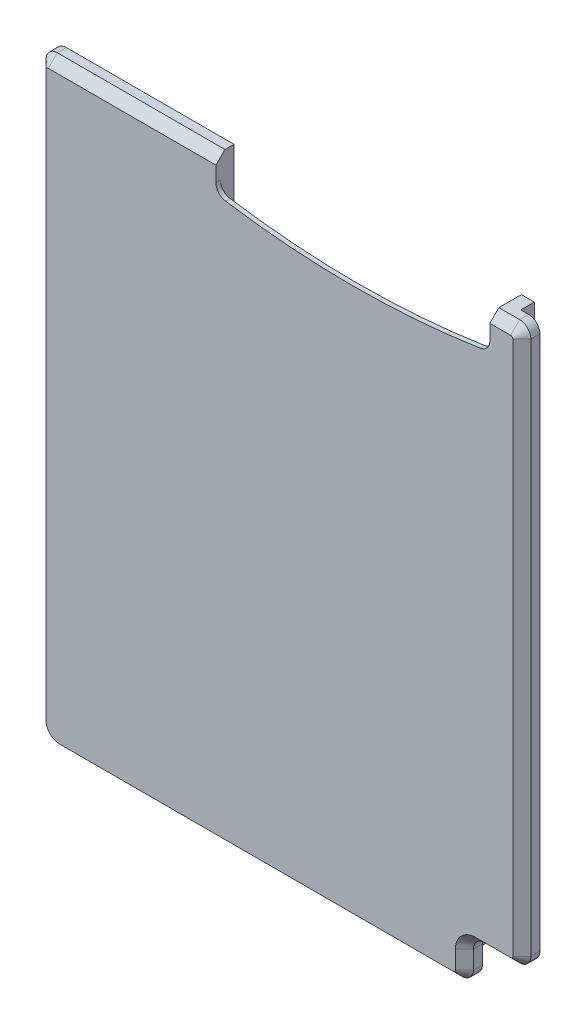
from build123d import *

# Parameters (mm, degrees)
SKIZZE2_W                                   = 21.5
SKIZZE2_H                                   = 26.5
AUFSATZ_LINEAR_AUSTRAGEN1_DEPTH             = 0.8
AUFSATZ_LINEAR_AUSTRAGEN2_DEPTH             = 0.6
SCHNITT_LINEAR_AUSTRAGEN2_DEPTH             = 0.7
SCHNITT_LINEAR_AUSTRAGEN2_DEPTH_BACK        = 40.270886163
SKIZZE5_W                                   = 12.144981168
SKIZZE5_H                                   = 8.613973721
SCHNITT_LINEAR_AUSTRAGEN1_DEPTH             = 0.4
SCHNITT_LINEAR_AUSTRAGEN1_DEPTH_BACK        = 40.270886163
SCHNITT_LINEAR_AUSTRAGEN3_DEPTH             = 0.6
SCHNITT_LINEAR_AUSTRAGEN3_DEPTH_BACK        = 40.270886163
SKIZZE6_W                                   = 12.144981168
SKIZZE6_H                                   = 8.023619308
VERRUNDUNG1_R                               = 0.5
SCHNITT_LINEAR_AUSTRAGEN4_DEPTH             = 40.270886163
SCHNITT_LINEAR_AUSTRAGEN4_DEPTH_BACK        = 40.270886163
VERRUNDUNG3_R                               = 0.5
SKIZZE8_W                                   = 5.461913831
SKIZZE8_H                                   = 1.2
SKIZZE8_W_2                                 = 0.8
SKIZZE8_H_2                                 = 4.167109648
AUFSATZ_LINEAR_AUSTRAGEN3_DEPTH             = 0.6
AUFSATZ_LINEAR_AUSTRAGEN3_DIRECTION_2_REACH = 41.271
SCHNITT_LINEAR_AUSTRAGEN5_DEPTH             = 40.270886163
SCHNITT_LINEAR_AUSTRAGEN5_DEPTH_BACK        = 40.270886163
SKIZZE9_W                                   = 2.954983754
SKIZZE9_H                                   = 2.164950306
SKIZZE10_W                                  = 0.770433568
SKIZZE10_H                                  = 2.170677495
AUFSATZ_LINEAR_AUSTRAGEN4_DEPTH             = 0.8
VERRUNDUNG2_R                               = 1
VERRUNDUNG4_R                               = 0.5
FASE1_SIZE                                  = 0.4


with BuildPart() as part:
    # Skizze2 → Aufsatz-Linear austragen1 (new body)
    with BuildSketch(Plane.XY.offset(1.2)):
        with Locations((12, 18.75)):
            Rectangle(SKIZZE2_W, SKIZZE2_H)
    extrude(amount=AUFSATZ_LINEAR_AUSTRAGEN1_DEPTH)

    # Skizze3 → Aufsatz-Linear austragen2 (add)
    with BuildSketch(Plane.XY.offset(1.2)):
        Polygon((21.9, 32), (21.9, 16.15), (19.9, 16.15), (19.9, 6.15), (2.1, 6.15), (2.1, 25.65), (10, 25.65), (10, 32), align=None)
    extrude(amount=-AUFSATZ_LINEAR_AUSTRAGEN2_DEPTH)

    # Skizze5 → Schnitt-Linear austragen2 (cut, two sides: drawn at the far end of the back side and taken through both)
    with BuildSketch(Plane.XY.offset(1.2).offset(-SCHNITT_LINEAR_AUSTRAGEN2_DEPTH_BACK)):
        with Locations((15.254893919, 20.77736777)):
            Rectangle(SKIZZE5_W, SKIZZE5_H)
    extrude(amount=SCHNITT_LINEAR_AUSTRAGEN2_DEPTH + SCHNITT_LINEAR_AUSTRAGEN2_DEPTH_BACK, mode=Mode.SUBTRACT)

    # Skizze4 → Schnitt-Linear austragen1 (cut, two sides: drawn at the far end of the back side and taken through both)
    with BuildSketch(Plane.XY.offset(1.2).offset(-SCHNITT_LINEAR_AUSTRAGEN1_DEPTH_BACK)):
        Polygon((8.382403335, 24.511668734), (5.015709698, 24.511668734), (5.015709698, 25.65), (2.1, 25.65), (2.1, 24.134887808), (2.6, 24.134887808), (2.6, 6.15), (7.902667193, 6.15), (7.902667193, 7.35), (10.352191741, 7.35), (10.352191741, 6.15), (16.321024544, 6.15), (16.321024544, 6.65), (19.9, 6.65), (19.9, 10.624393956), (18.922805677, 10.624393956), (18.922805677, 12.094523693), (18.263327803, 12.094523693), (18.263327803, 15.67038091), (19.9, 15.67038091), (19.9, 16.15), (21.327384503, 16.15), (21.327384503, 16.47038091), (16.321024544, 16.47038091), (16.321024544, 15.67038091), (5.294026876, 15.67038091), (5.294026876, 17.554984477), (8.382403335, 17.554984477), align=None)
    extrude(amount=SCHNITT_LINEAR_AUSTRAGEN1_DEPTH + SCHNITT_LINEAR_AUSTRAGEN1_DEPTH_BACK, mode=Mode.SUBTRACT)

    # Skizze6 → Schnitt-Linear austragen3 (cut, two sides: drawn at the far end of the back side and taken through both)
    with BuildSketch(Plane.XY.offset(1.2).offset(-SCHNITT_LINEAR_AUSTRAGEN3_DEPTH_BACK)):
        with Locations((15.254893919, 29.096164285)):
            Rectangle(SKIZZE6_W, SKIZZE6_H)
    extrude(amount=SCHNITT_LINEAR_AUSTRAGEN3_DEPTH + SCHNITT_LINEAR_AUSTRAGEN3_DEPTH_BACK, mode=Mode.SUBTRACT)

    # Verrundung1
    verrundung1_edges = [part.edges().sort_by_distance(p)[0] for p in [
        (21.9, 16.15, 0.9),
        (2.1, 25.65, 1.4),
        (2.1, 6.15, 0.9),
        (19.9, 6.15, 0.9),
    ]]
    fillet(verrundung1_edges, radius=VERRUNDUNG1_R - 0.0001)  # a hair under: the kernel refuses the full size

    # Skizze7 → Schnitt-Linear austragen4 (cut, two sides: drawn at the far end of the back side and taken through both)
    with BuildSketch(Plane.XY.offset(1.2).offset(-SCHNITT_LINEAR_AUSTRAGEN4_DEPTH_BACK)):
        with BuildLine():
            Line((21.327384503, 30.5), (21.327384503, 32.799881912))
            Line((21.327384503, 32.799881912), (9.182403335, 32.799881912))
            Line((9.182403335, 32.799881912), (9.182403335, 30.5))
            ThreePointArc((9.182403335, 30.5), (15.254893919, 30), (21.327384503, 30.5))
        make_face()
    extrude(amount=SCHNITT_LINEAR_AUSTRAGEN4_DEPTH + SCHNITT_LINEAR_AUSTRAGEN4_DEPTH_BACK, mode=Mode.SUBTRACT)

    # Verrundung3
    verrundung3_edges = [part.edges().sort_by_distance(p)[0] for p in [
        (9.182403335, 30.5, 1.9),
        (21.327384503, 30.5, 1.9),
    ]]
    fillet(verrundung3_edges, radius=VERRUNDUNG3_R)

    # Skizze8 → Aufsatz-Linear austragen3 (add)
    with BuildSketch(Plane.XY.offset(1.2)):
        with Locations((4.988422265, 11.700335539)):
            Rectangle(SKIZZE8_W, SKIZZE8_H)
        with Locations((16.376411907, 10.759758473)):
            Rectangle(SKIZZE8_W_2, SKIZZE8_H_2)
    extrude(amount=-AUFSATZ_LINEAR_AUSTRAGEN3_DEPTH)

    # Skizze8 → Aufsatz-Linear austragen3 direction 2 (add, up to next)
    with BuildSketch(Plane.XY.offset(1.2), mode=Mode.PRIVATE) as aufsatz_linear_austragen3_direction_2_sk1:
        with Locations((4.988422265, 11.700335539)):
            Rectangle(SKIZZE8_W, SKIZZE8_H)
    aufsatz_linear_austragen3_direction_2_tool1 = extrude(aufsatz_linear_austragen3_direction_2_sk1.sketch, amount=AUFSATZ_LINEAR_AUSTRAGEN3_DIRECTION_2_REACH, mode=Mode.PRIVATE) - part.part
    # Skizze8 → Aufsatz-Linear austragen3 direction 2 (add, up to next)
    with BuildSketch(Plane.XY.offset(1.2), mode=Mode.PRIVATE) as aufsatz_linear_austragen3_direction_2_sk2:
        with Locations((16.376411907, 10.759758473)):
            Rectangle(SKIZZE8_W_2, SKIZZE8_H_2)
    aufsatz_linear_austragen3_direction_2_tool2 = extrude(aufsatz_linear_austragen3_direction_2_sk2.sketch, amount=AUFSATZ_LINEAR_AUSTRAGEN3_DIRECTION_2_REACH, mode=Mode.PRIVATE) - part.part
    add(aufsatz_linear_austragen3_direction_2_tool1.solids().sort_by_distance((4.988422, 11.700336, 1.2))[0])
    add(aufsatz_linear_austragen3_direction_2_tool2.solids().sort_by_distance((16.376412, 10.759758, 1.2))[0])

    # Skizze9 → Schnitt-Linear austragen5 (cut, two sides: drawn at the far end of the back side and taken through both)
    with BuildSketch(Plane.XY.offset(1.2).offset(-SCHNITT_LINEAR_AUSTRAGEN5_DEPTH_BACK)):
        with Locations((21.677491877, 6.217524847)):
            Rectangle(SKIZZE9_W, SKIZZE9_H)
    extrude(amount=SCHNITT_LINEAR_AUSTRAGEN5_DEPTH + SCHNITT_LINEAR_AUSTRAGEN5_DEPTH_BACK, mode=Mode.SUBTRACT)

    # Skizze10 → Aufsatz-Linear austragen4 (add)
    with BuildSketch(Plane.XY.offset(1.2)):
        with Locations((19.652022519, 6.998720979)):
            Rectangle(SKIZZE10_W, SKIZZE10_H)
    extrude(amount=AUFSATZ_LINEAR_AUSTRAGEN4_DEPTH)

    # Verrundung2
    verrundung2_edges = [part.edges().sort_by_distance(p)[0] for p in [
        (1.25, 5.5, 1.6),
    ]]
    fillet(verrundung2_edges, radius=VERRUNDUNG2_R)

    # Verrundung4
    verrundung4_edges = [part.edges().sort_by_distance(p)[0] for p in [
        (22.75, 7.3, 1.6),
        (20.2, 5.5, 1.6),
        (20.2, 7.3, 1.6),
        (1.25, 32, 1.6),
        (22.75, 32, 1.6),
    ]]
    fillet(verrundung4_edges, radius=VERRUNDUNG4_R)

    # Fase1
    fase1_edges = [part.edges().sort_by_distance(p)[0] for p in [
        (5.466201668, 32, 2),
        (10.975, 5.5, 2),
        (1.542893219, 5.792893219, 2),
        (22.75, 19.65, 2),
        (21.475, 7.3, 2),
        (1.25, 19, 2),
        (20.2, 6.4, 2),
        (21.788692251, 32, 2),
        (1.396446609, 31.853553391, 2),
        (22.603553391, 31.853553391, 2),
        (20.053553391, 5.646446609, 2),
        (22.603553391, 7.446446609, 2),
        (20.346446609, 7.153553391, 2),
    ]]
    chamfer(fase1_edges, length=FASE1_SIZE)


solid = part.part
